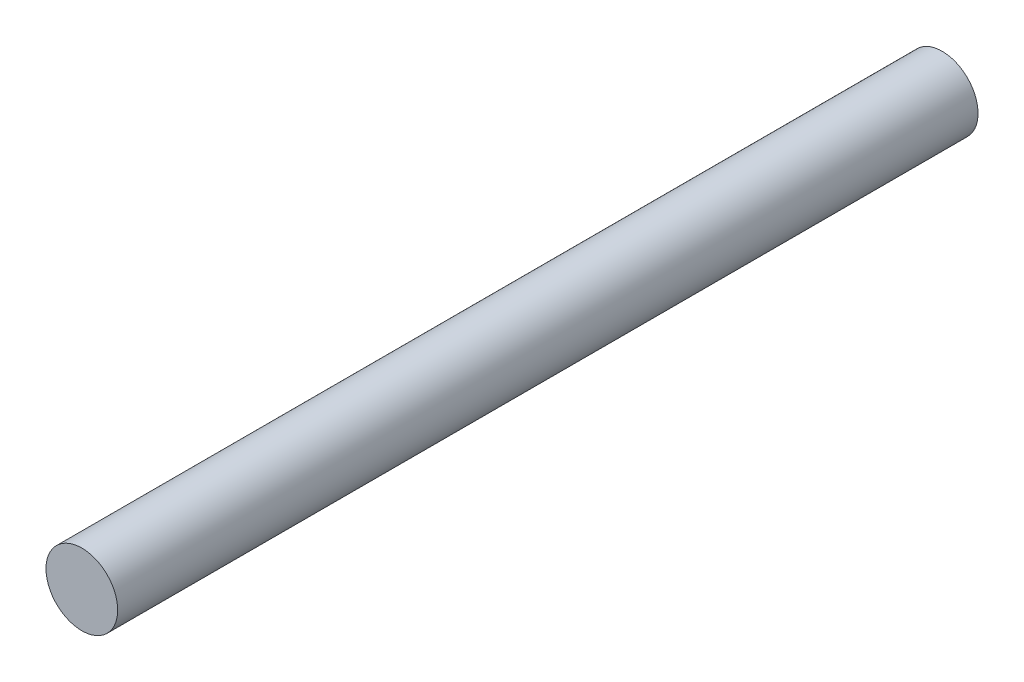
from build123d import *

# Parameters (mm, degrees)
SKETCH1_R           = 6.35
BOSS_EXTRUDE1_DEPTH = 152.4


with BuildPart() as part:
    # Sketch1 → Boss-Extrude1 (new body)
    with BuildSketch(Plane.XY):
        Circle(SKETCH1_R)
    extrude(amount=BOSS_EXTRUDE1_DEPTH)


solid = part.part
